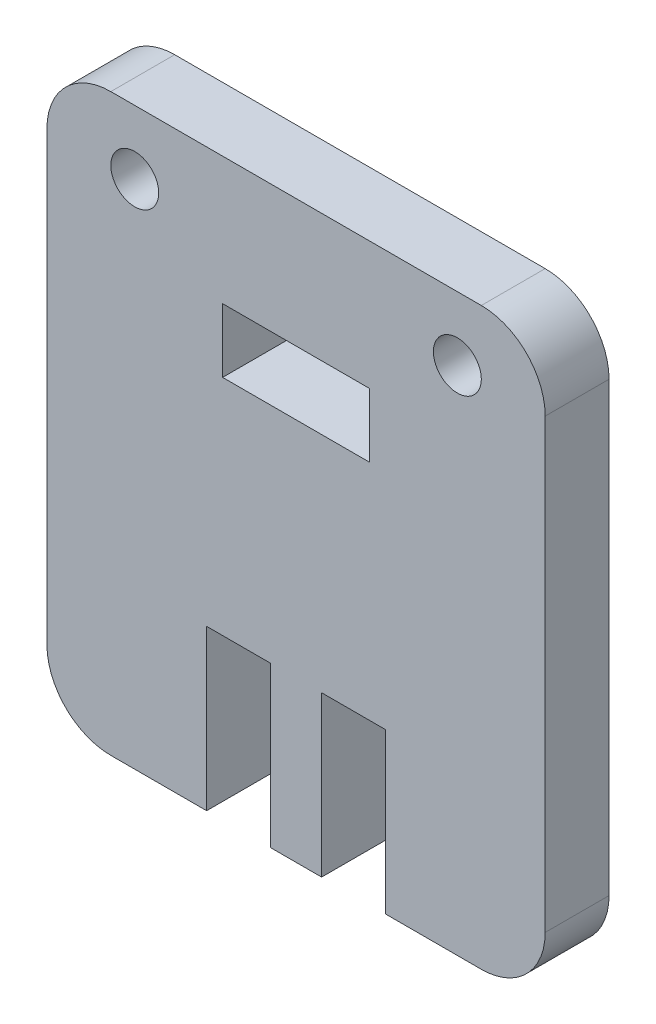
from build123d import *

# Parameters (mm, degrees)
MODEL_R             = 0.75
MODEL_W             = 4.6
MODEL_H             = 2
BOSS_EXTRUDE1_DEPTH = 2


with BuildPart() as part:
    # Model → Boss-Extrude1 (new body)
    with BuildSketch(Plane.XY):
        with BuildLine():
            Line((2, 0), (5, 0))
            Line((5, 0), (5, 5))
            Line((5, 5), (7, 5))
            Line((7, 5), (7, 0))
            Line((7, 0), (8.6, 0))
            Line((8.6, 0), (8.6, 5))
            Line((8.6, 5), (10.6, 5))
            Line((10.6, 5), (10.6, 0))
            Line((10.6, 0), (13.6, 0))
            ThreePointArc((13.6, 0), (15.014213562, 0.585786438), (15.6, 2))
            Line((15.6, 2), (15.6, 16))
            ThreePointArc((15.6, 16), (15.014213562, 17.414213562), (13.6, 18))
            Line((13.6, 18), (2, 18))
            ThreePointArc((2, 18), (0.585786438, 17.414213562), (0, 16))
            Line((0, 16), (0, 2))
            ThreePointArc((0, 2), (0.585786438, 0.585786438), (2, 0))
        make_face()
        with Locations((2.75, 16)):
            Circle(MODEL_R, mode=Mode.SUBTRACT)
        with Locations((12.85, 16)):
            Circle(MODEL_R, mode=Mode.SUBTRACT)
        with Locations((7.8, 13)):
            Rectangle(MODEL_W, MODEL_H, mode=Mode.SUBTRACT)
    extrude(amount=BOSS_EXTRUDE1_DEPTH)


solid = part.part
